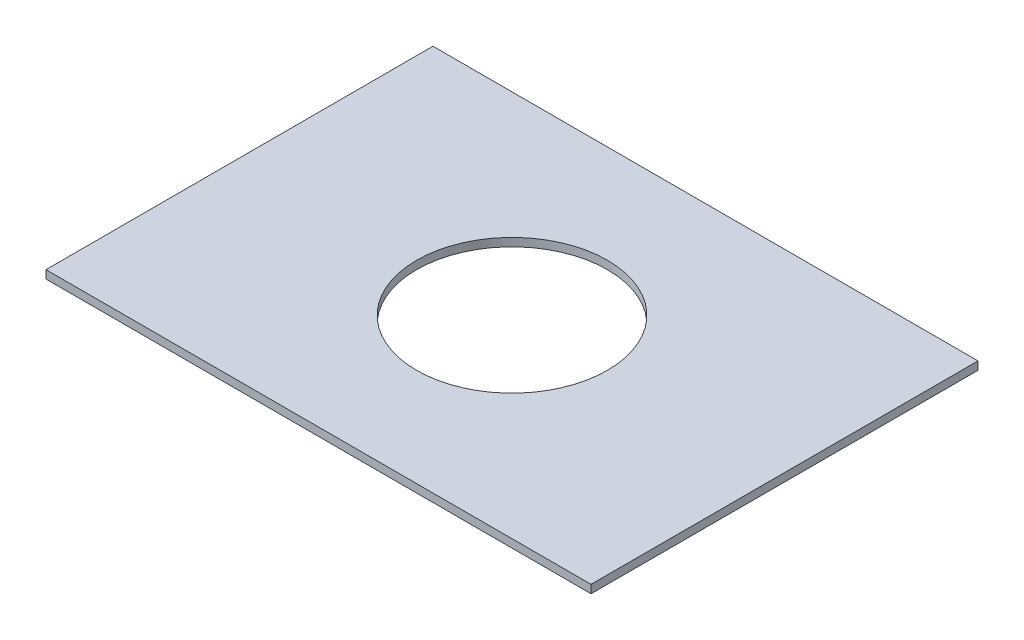
from build123d import *

# Parameters (mm, degrees)
ESQUISSE1_W             = 103
ESQUISSE1_H             = 75
BOSS_EXTRU_1_DEPTH      = 1.5
ESQUISSE3_W             = 103
ESQUISSE3_H             = 75
ESQUISSE3_W_2           = 100
ESQUISSE3_H_2           = 72
ENL_V_MAT_EXTRU_1_DEPTH = 10
ESQUISSE6_W             = 100
ESQUISSE6_H             = 1
ENL_V_MAT_EXTRU_3_DEPTH = 10
ESQUISSE7_R             = 17.5
ENL_V_MAT_EXTRU_4_DEPTH = 10


with BuildPart() as part:
    # Esquisse1 → Boss.-Extru.1 (new body)
    with BuildSketch(Plane(origin=(0, 0, 0), x_dir=(1, 0, 0), z_dir=(0, 1, 0))):
        with Locations((51.5, 37.5)):
            Rectangle(ESQUISSE1_W, ESQUISSE1_H)
    extrude(amount=BOSS_EXTRU_1_DEPTH)

    # Esquisse3 → Enlèv. mat.-Extru.1 (cut)
    with BuildSketch(Plane(origin=(0, 1.5, 0), x_dir=(1, 0, 0), z_dir=(0, 1, 0))):
        with Locations((51.5, 37.5)):
            Rectangle(ESQUISSE3_W, ESQUISSE3_H)
        with Locations((51.5, 37.5)):
            Rectangle(ESQUISSE3_W_2, ESQUISSE3_H_2, mode=Mode.SUBTRACT)
    extrude(amount=-ENL_V_MAT_EXTRU_1_DEPTH, mode=Mode.SUBTRACT)

    # Esquisse6 → Enlèv. mat.-Extru.3 (cut)
    with BuildSketch(Plane(origin=(0, 1.5, 0), x_dir=(1, 0, 0), z_dir=(0, 1, 0))):
        with Locations((51.5, 73)):
            Rectangle(ESQUISSE6_W, ESQUISSE6_H)
    extrude(amount=-ENL_V_MAT_EXTRU_3_DEPTH, mode=Mode.SUBTRACT)

    # Esquisse7 → Enlèv. mat.-Extru.4 (cut)
    with BuildSketch(Plane(origin=(0, 1.5, 0), x_dir=(1, 0, 0), z_dir=(0, 1, 0))):
        with Locations((51.5, 37)):
            Circle(ESQUISSE7_R)
    extrude(amount=-ENL_V_MAT_EXTRU_4_DEPTH, mode=Mode.SUBTRACT)


solid = part.part
